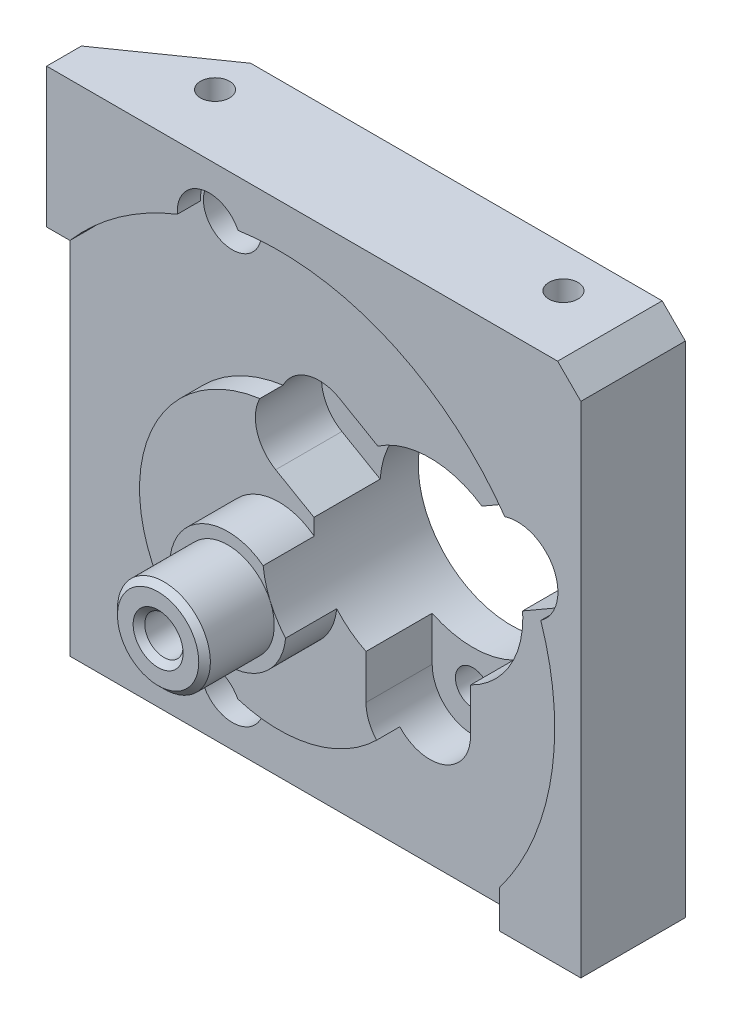
from build123d import *

# Parameters (mm, degrees)
SKETCH_1_W                 = 52
SKETCH_1_H                 = 47
EXTRUDE_1_DEPTH            = 9
SKETCH_19_R                = 23.75
SKETCH_19_R_2              = 12
CUT_EXTRUDE_2_DEPTH        = 2
SKETCH_20_R                = 5
EXTRUDE_3_DEPTH            = 4.4
SKETCH_21_R                = 4
EXTRUDE_4_DEPTH            = 6
SKETCH_22_R                = 8
CUT_EXTRUDE_5_DEPTH        = 39
CUT_EXTRUDE_6_DEPTH        = 47
HOLE_WIZARD_M3_1_D         = 2.5
HOLE_WIZARD_M3_1_DEPTH     = 9.5
HOLE_WIZARD_M3_1_TIP       = 0.751075774
HOLE_WIZARD_M4_2_D         = 3.3
HOLE_WIZARD_M4_2_DEPTH     = 10.1
HOLE_WIZARD_M4_2_TIP       = 0.991420021
CHAMFER_3_SIZE             = 0.5
CHAMFER_6_SIZE             = 2
EXTRUDE3_DEPTH             = 2
EXTRUDE4_REACH             = 57.474
SKETCH_35_R                = 3.25
CUT_EXTRUDE_1_DEPTH        = 2
PATTERN_CIRCULAR_1_COUNT   = 3
HOLE_WIZARD_2_AT_2_COUNT   = 2
HOLE_WIZARD_2_AT_2_PITCH   = 19.052558883
HOLE_WIZARD_2_AT_3_COUNT   = 2
HOLE_WIZARD_2_AT_3_PITCH   = 19.052558883
HOLE_WIZARD_M3_2_D         = 2.5
HOLE_WIZARD_M3_2_DEPTH     = 7.5
HOLE_WIZARD_M3_2_TIP       = 0.751075774
CUT_EXTRUDE_START          = 10
CUT_EXTRUDE_3_DEPTH        = 10
SKETCH_42_R                = 2
CUT_EXTRUDE_4_DEPTH        = 2
CHAMFER_7_SIZE             = 0.5
SKETCH_43_R                = 1
CUT_EXTRUDE_5_2_DEPTH      = 5
SKETCH_44_R                = 2.75
CUT_EXTRUDE_7_DEPTH        = 2
HOLE_WIZARD_2_2_AT_2_COUNT = 2
HOLE_WIZARD_2_2_AT_2_PITCH = 35
SKETCH_46_R                = 2.25
CUT_EXTRUDE_8_DEPTH        = 3
SKETCH_48_W                = 2.005209087
SKETCH_48_H                = 2.691311543
SKETCH_48_W_2              = 2.943459277
SKETCH_48_H_2              = 3.25
CUT_EXTRUDE_9_DEPTH        = 2
CUT_EXTRUDE_START_2        = 7
CUT_EXTRUDE_12_DEPTH       = 7
CUT_EXTRUDE_13_OUTLINE_R   = 2.75
CUT_EXTRUDE_13_DEPTH       = 5
CUT_EXTRUDE_START_3        = -0.7
CUT_EXTRUDE_13_2_DEPTH     = 0.7


# Read off the part's stored shape, not the designer's step: 切除-拉伸13
with BuildPart() as part:
    # 草图1 → 拉伸1 (new body)
    with BuildSketch(Plane.XY):
        Rectangle(SKETCH_1_W, SKETCH_1_H)
    extrude(amount=EXTRUDE_1_DEPTH)

    # 草图19 → Cut-Extrude 2 (cut)
    with BuildSketch(Plane.XY.offset(9)):
        with Locations((0, -4)):
            Circle(SKETCH_19_R)
        with Locations((0, -4)):
            Circle(SKETCH_19_R_2, mode=Mode.SUBTRACT)
    extrude(amount=-CUT_EXTRUDE_2_DEPTH, mode=Mode.SUBTRACT)

    # 草图20 → 拉伸3 (add)
    with BuildSketch(Plane.XY.offset(9)):
        with Locations((0, -4)):
            Circle(SKETCH_20_R)
    extrude(amount=EXTRUDE_3_DEPTH)

    # 草图21 → 拉伸4 (add)
    with BuildSketch(Plane.XY.offset(13.4)):
        with Locations((0, -4)):
            Circle(SKETCH_21_R)
    extrude(amount=EXTRUDE_4_DEPTH)

    # 草图22 → Cut-Extrude 5 (cut, symmetric)
    with BuildSketch(Plane.XY.offset(9)):
        with Locations((11, 0.795831523)):
            Circle(SKETCH_22_R)
    extrude(amount=CUT_EXTRUDE_5_DEPTH, both=True, mode=Mode.SUBTRACT)

    # 草图25 → 拉伸6 (cut)
    with BuildSketch(Plane.XZ.offset(23.5)):
        Polygon((-26, 8), (-14.574815946, 0), (-26, 0), align=None)
    extrude(amount=-CUT_EXTRUDE_6_DEPTH, mode=Mode.SUBTRACT)

    # M3 螺纹孔1
    with Locations(Plane(origin=(-11, 23.5, 3.5), x_dir=(0, 0, 1), z_dir=(0, 1, 0))):
        with Locations((0, 0), (0, 30)):
            Hole(HOLE_WIZARD_M3_1_D / 2, depth=HOLE_WIZARD_M3_1_DEPTH)
            with Locations((0, 0, -(HOLE_WIZARD_M3_1_DEPTH + HOLE_WIZARD_M3_1_TIP / 2))):  # 118° drill point
                Cone(0, HOLE_WIZARD_M3_1_D / 2, HOLE_WIZARD_M3_1_TIP, mode=Mode.SUBTRACT)

    # M4 螺纹孔2
    with Locations(Plane(origin=(0, -4, 19.4), x_dir=(1, 0, 0), z_dir=(0, 0, 1))):
        with Locations((0, 0)):
            Hole(HOLE_WIZARD_M4_2_D / 2, depth=HOLE_WIZARD_M4_2_DEPTH)
            with Locations((0, 0, -(HOLE_WIZARD_M4_2_DEPTH + HOLE_WIZARD_M4_2_TIP / 2))):  # 118° drill point
                Cone(0, HOLE_WIZARD_M4_2_D / 2, HOLE_WIZARD_M4_2_TIP, mode=Mode.SUBTRACT)

    # 倒角3
    chamfer_3_edges = [part.edges().sort_by_distance(p)[0] for p in [
        (-4, -4, 19.4),
        (1.65, -4, 19.4),
    ]]
    chamfer(chamfer_3_edges, length=CHAMFER_3_SIZE)

    # 倒角6
    chamfer_6_edges = [part.edges().sort_by_distance(p)[0] for p in [
        (26, 23.5, 4.5),
    ]]
    chamfer(chamfer_6_edges, length=CHAMFER_6_SIZE)

    # Sketch6 → Extrude3 (cut)
    with BuildSketch(Plane.XZ.offset(23.5)):
        Polygon((-26, 9), (-26, 8), (-14.574815946, 0), (26, 0), (26, 9), (13.557746863, 9), (13.557746863, 7), (-13.557746863, 7), (-13.557746863, 9), align=None)
    extrude(amount=-EXTRUDE3_DEPTH, mode=Mode.SUBTRACT)

    # Extrude4: up to this face of the body (flat: up to its plane)
    extrude4_end = Plane(part.part.faces().sort_by_distance((1.330613504, 23.5, 4.737278788))[0])
    # Sketch7 → Extrude4 (cut, up to the picked face)
    with BuildSketch(Plane.XZ.offset(21.5), mode=Mode.PRIVATE) as extrude4_sk1:
        Polygon((-20, 9), (-20, 6), (-11.43111196, 0), (-14.574815946, 0), (-26, 8), (-26, 9), align=None)
    extrude4_tool1 = split(extrude(extrude4_sk1.sketch, amount=-EXTRUDE4_REACH, mode=Mode.PRIVATE), bisect_by=extrude4_end, keep=Keep.BOTH, mode=Mode.PRIVATE)
    add(extrude4_tool1.solids().sort_by(Axis((-19.659359, -21.5, 5.073959), (0, 1, 0)))[0], mode=Mode.SUBTRACT)

    # 草图35 → 切除-拉伸1 (cut)
    with BuildSketch(Plane.XY.offset(9)):
        with Locations((1.473720558, 6.295831523)):
            Circle(SKETCH_35_R)
    cut_extrude_1 = extrude(amount=-CUT_EXTRUDE_1_DEPTH, mode=Mode.SUBTRACT)

    # 阵列(圆周)1: 切除-拉伸1 ×3 about axis
    pattern_circular_1_axis = Axis((11, 0.795831523, 0), (0, 0, 1))
    for i in range(1, PATTERN_CIRCULAR_1_COUNT):
        add(cut_extrude_1.rotate(pattern_circular_1_axis, i * 360 / PATTERN_CIRCULAR_1_COUNT), mode=Mode.SUBTRACT)

    # 草图36 → Hole Wizard 2 (revolve, cut)
    with BuildSketch(Plane(origin=(1.473720558, 6.295831523, 7), x_dir=(0, -1, 0), z_dir=(1, 0, 0))):
        Polygon((0, 0), (0, 7), (1.5, 7), (1.5, 3.7), (3.5, 3.7), (3.5, 0), align=None)
    hole_wizard_2 = revolve(axis=Axis((1.473720558, 6.295831523, 13.35), (0, 0, -1)), mode=Mode.SUBTRACT)

    # Hole Wizard 2 at 2: Hole Wizard 2 ×2
    with Locations(*[(i * HOLE_WIZARD_2_AT_2_PITCH, 0, 0) for i in range(1, HOLE_WIZARD_2_AT_2_COUNT)]):
        add(hole_wizard_2, mode=Mode.SUBTRACT)

    # Hole Wizard 2 at 3: Hole Wizard 2 ×2
    with Locations(*[Vector(0.49999999999999806, -0.8660254037844398, 0) * (i * HOLE_WIZARD_2_AT_3_PITCH) for i in range(1, HOLE_WIZARD_2_AT_3_COUNT)]):
        add(hole_wizard_2, mode=Mode.SUBTRACT)

    # M3 螺纹孔2
    with Locations(Plane(origin=(-11, -21.5, 3.5), x_dir=(0, 0, -1), z_dir=(0, -1, 0))):
        with Locations((0, 0), (0, 35)):
            Hole(HOLE_WIZARD_M3_2_D / 2, depth=HOLE_WIZARD_M3_2_DEPTH)
            with Locations((0, 0, -(HOLE_WIZARD_M3_2_DEPTH + HOLE_WIZARD_M3_2_TIP / 2))):  # 118° drill point
                Cone(0, HOLE_WIZARD_M3_2_D / 2, HOLE_WIZARD_M3_2_TIP, mode=Mode.SUBTRACT)

    # 草图41 → 切除-拉伸3 (cut)
    with BuildSketch(Plane.XY.offset(7).offset(CUT_EXTRUDE_START)):
        with BuildLine():
            Line((1.473720558, 9.795831523), (7.585559388, 9.795831523))
            ThreePointArc((7.585559388, 9.795831523), (11.085559388, 6.295831523), (7.585559388, 2.795831523))
            Line((7.585559388, 2.795831523), (1.473720558, 2.795831523))
            ThreePointArc((1.473720558, 2.795831523), (-2.026279442, 6.295831523), (1.473720558, 9.795831523))
        make_face()
    extrude(amount=-CUT_EXTRUDE_3_DEPTH, mode=Mode.SUBTRACT)

    # 草图42 → 切除-拉伸4 (cut)
    with BuildSketch(Plane(origin=(0, 0, 0), x_dir=(-1, 0, 0), z_dir=(0, 0, -1))):
        with Locations((6, 18.295831523)):
            Circle(SKETCH_42_R)
        with Locations((6, -16.704168477)):
            Circle(SKETCH_42_R)
    extrude(amount=-CUT_EXTRUDE_4_DEPTH, mode=Mode.SUBTRACT)

    # 倒角7
    chamfer_7_edges = [part.edges().sort_by_distance(p)[0] for p in [
        (-4, 18.295831523, 0),
        (-4, -16.704168477, 0),
    ]]
    chamfer(chamfer_7_edges, length=CHAMFER_7_SIZE)

    # 草图43 → Cut-Extrude 5 2 (cut)
    with BuildSketch(Plane(origin=(0, 0, 2), x_dir=(-1, 0, 0), z_dir=(0, 0, -1))):
        with Locations((6, 18.295831523)):
            Circle(SKETCH_43_R)
        with Locations((6, -16.704168477)):
            Circle(SKETCH_43_R)
    extrude(amount=-CUT_EXTRUDE_5_2_DEPTH, mode=Mode.SUBTRACT)

    # 草图44 → 切除-拉伸7 (cut)
    with BuildSketch(Plane.XY.offset(9)):
        with Locations((-6, 18.295831523)):
            Circle(SKETCH_44_R)
    extrude(amount=-CUT_EXTRUDE_7_DEPTH, mode=Mode.SUBTRACT)

    # 草图45 → Hole Wizard 2 2 (revolve, cut)
    with BuildSketch(Plane(origin=(-6, 18.295831523, 7), x_dir=(0, -1, 0), z_dir=(1, 0, 0))):
        Polygon((0, 0), (0, 7), (1, 7), (1, 3), (2.5, 3), (2.5, 0), align=None)
    hole_wizard_2_2 = revolve(axis=Axis((-6, 18.295831523, 13.35), (0, 0, -1)), mode=Mode.SUBTRACT)

    # Hole Wizard 2 2 at 2: Hole Wizard 2 2 ×2
    with Locations(*[(0, -i * HOLE_WIZARD_2_2_AT_2_PITCH, 0) for i in range(1, HOLE_WIZARD_2_2_AT_2_COUNT)]):
        add(hole_wizard_2_2, mode=Mode.SUBTRACT)

    # 草图46 → 切除-拉伸8 (cut)
    with BuildSketch(Plane.XY.offset(7)):
        with Locations((-6, -16.704168477)):
            Circle(SKETCH_46_R)
    extrude(amount=CUT_EXTRUDE_8_DEPTH, mode=Mode.SUBTRACT)

    # 草图48 → 切除-拉伸9 (cut)
    with BuildSketch(Plane.XY.offset(9)):
        Polygon((-20, -21.5), (-16.056540723, -21.5), (-20, -16.808688457), align=None)
        with Locations((-18.997395457, 10.154344229)):
            Rectangle(SKETCH_48_W, SKETCH_48_H)
        with Locations((17.528270361, -19.875)):
            Rectangle(SKETCH_48_W_2, SKETCH_48_H_2)
    extrude(amount=-CUT_EXTRUDE_9_DEPTH, mode=Mode.SUBTRACT)

    # 草图52 → 切除-拉伸12 (cut)
    with BuildSketch(Plane.XY.offset(3.3).offset(CUT_EXTRUDE_START_2)):
        with BuildLine():
            Line((7.5, -10.204168477), (7.5, 0.795831523))
            ThreePointArc((7.5, 0.795831523), (11, 4.295831523), (14.5, 0.795831523))
            Line((14.5, 0.795831523), (14.5, -10.204168477))
            ThreePointArc((14.5, -10.204168477), (11, -13.704168477), (7.5, -10.204168477))
        make_face()
    extrude(amount=-CUT_EXTRUDE_12_DEPTH, mode=Mode.SUBTRACT)

    # 切除-拉伸13 outline → 切除-拉伸13 (cut)
    with BuildSketch(Plane.XY.offset(4)):
        with BuildLine():
            Line((18.979967897, 1.361616253), (22.276279442, 3.26474261))
            ThreePointArc((22.276279442, 3.26474261), (23.557368355, 8.045831523), (18.776279442, 9.326920437))
            Line((18.776279442, 9.326920437), (15.479967897, 7.423794079))
            ThreePointArc((15.479967897, 7.423794079), (17.92820323, 4.795831523), (18.979967897, 1.361616253))
        make_face()
        with BuildLine():
            ThreePointArc((4.964881512, 6.047245127), (5.697596566, 6.786200278), (6.520032103, 7.423794079))
            Line((6.520032103, 7.423794079), (3.223720558, 9.326920437))
            ThreePointArc((3.223720558, 9.326920437), (4.56508103, 7.937017202), (4.964881512, 6.047245127))
        make_face()
        with BuildLine():
            Line((-0.276279442, 3.26474261), (3.020032103, 1.361616253))
            ThreePointArc((3.020032103, 1.361616253), (3.160986763, 2.392663221), (3.43458317, 3.396690647))
            ThreePointArc((3.43458317, 3.396690647), (1.598092305, 2.798041983), (-0.276279442, 3.26474261))
        make_face()
        with Locations((-6, -16.704168477)):
            Circle(CUT_EXTRUDE_13_OUTLINE_R)
    extrude(amount=CUT_EXTRUDE_13_DEPTH, mode=Mode.SUBTRACT)

    # Cut-Extrude 13 2 outline → Cut-Extrude 13 2 (cut)
    with BuildSketch(Plane.XY.offset(4).offset(CUT_EXTRUDE_START_3)):
        with BuildLine():
            Line((18.979967897, 1.361616253), (22.276279442, 3.26474261))
            ThreePointArc((22.276279442, 3.26474261), (20.401907695, 2.798041983), (18.56541683, 3.396690647))
            ThreePointArc((18.56541683, 3.396690647), (18.839013237, 2.392663221), (18.979967897, 1.361616253))
        make_face()
        with BuildLine():
            ThreePointArc((17.035118488, 6.047245127), (17.43491897, 7.937017202), (18.776279442, 9.326920437))
            Line((18.776279442, 9.326920437), (15.479967897, 7.423794079))
            ThreePointArc((15.479967897, 7.423794079), (16.302403434, 6.786200278), (17.035118488, 6.047245127))
        make_face()
        with BuildLine():
            ThreePointArc((4.964881512, 6.047245127), (5.697596566, 6.786200278), (6.520032103, 7.423794079))
            Line((6.520032103, 7.423794079), (3.223720558, 9.326920437))
            ThreePointArc((3.223720558, 9.326920437), (4.56508103, 7.937017202), (4.964881512, 6.047245127))
        make_face()
        with BuildLine():
            Line((-0.276279442, 3.26474261), (3.020032103, 1.361616253))
            ThreePointArc((3.020032103, 1.361616253), (3.160986763, 2.392663221), (3.43458317, 3.396690647))
            ThreePointArc((3.43458317, 3.396690647), (1.598092305, 2.798041983), (-0.276279442, 3.26474261))
        make_face()
    extrude(amount=CUT_EXTRUDE_13_2_DEPTH, mode=Mode.SUBTRACT)


solid = part.part
